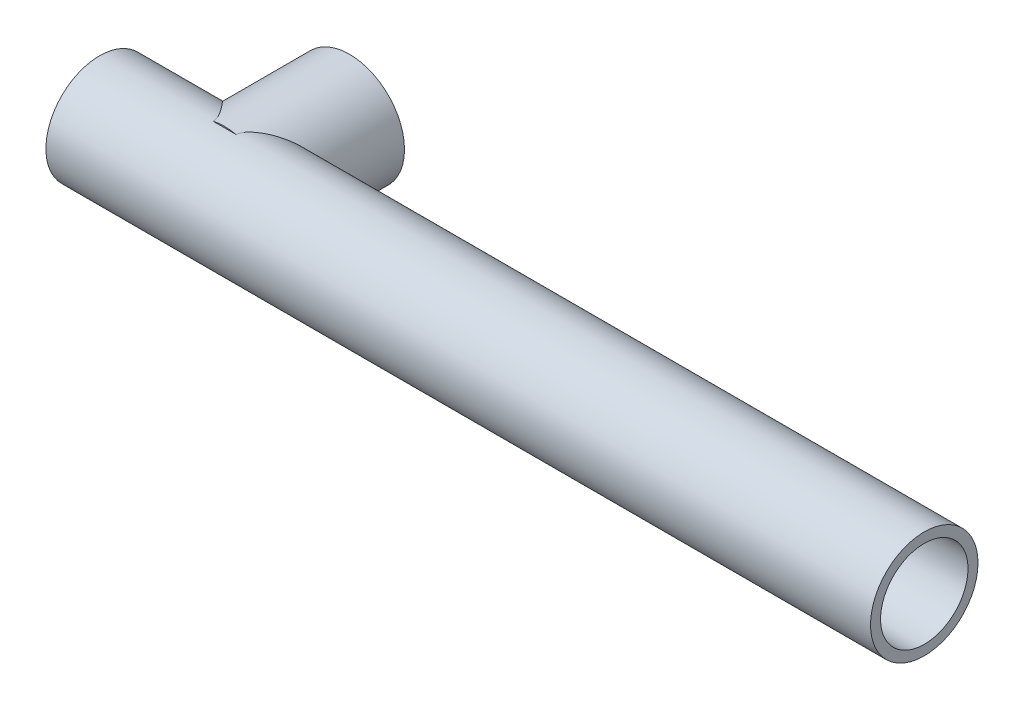
from build123d import *
from build123d.topology import SkipClean

# Parameters (mm, degrees)
SKETCH_1_R          = 10.75
SKETCH_1_R_2        = 8.75
EXTRUDE_1_DEPTH     = 165
SKETCH_2_R          = 9
CUT_EXTRUDE_1_DEPTH = 29
SKETCH_3_R          = 11
SKETCH_3_R_2        = 9
EXTRUDE_2_DEPTH     = 25
CUT_EXTRUDE_2_DEPTH = 169


with BuildPart() as part:
    # 草图1 → 拉伸-薄壁1 (new body)
    with BuildSketch(Plane(origin=(0, 0, 0), x_dir=(0, 0, -1), z_dir=(1, 0, 0))):
        Circle(SKETCH_1_R)
        Circle(SKETCH_1_R_2, mode=Mode.SUBTRACT)
    extrude(amount=EXTRUDE_1_DEPTH)

    # 草图2 → 切除-拉伸1 (cut)
    with BuildSketch(Plane.XY):
        with Locations((25, 0)):
            Circle(SKETCH_2_R)
    extrude(amount=-CUT_EXTRUDE_1_DEPTH, mode=Mode.SUBTRACT)

    # 草图3 → 拉伸-薄壁2 (add)
    with BuildSketch(Plane.XY):
        with Locations((25, 0)):
            Circle(SKETCH_3_R)
        with Locations((25, 0)):
            Circle(SKETCH_3_R_2, mode=Mode.SUBTRACT)
    extrude(amount=-EXTRUDE_2_DEPTH)

    # 草图4 → 切除-拉伸2 (cut)
    with SkipClean():  # the faces are left unmerged after this step: merging them gives an invalid solid
        with BuildSketch(Plane.ZY):
            with BuildLine():
                ThreePointArc((8.75, 0), (6.187184335, 6.187184335), (0, 8.75))
                ThreePointArc((0, 8.75), (-8.75, 0), (0, -8.75))
                ThreePointArc((0, -8.75), (6.187184335, -6.187184335), (8.75, 0))
            make_face()
        extrude(amount=-CUT_EXTRUDE_2_DEPTH, mode=Mode.SUBTRACT)


solid = part.part
